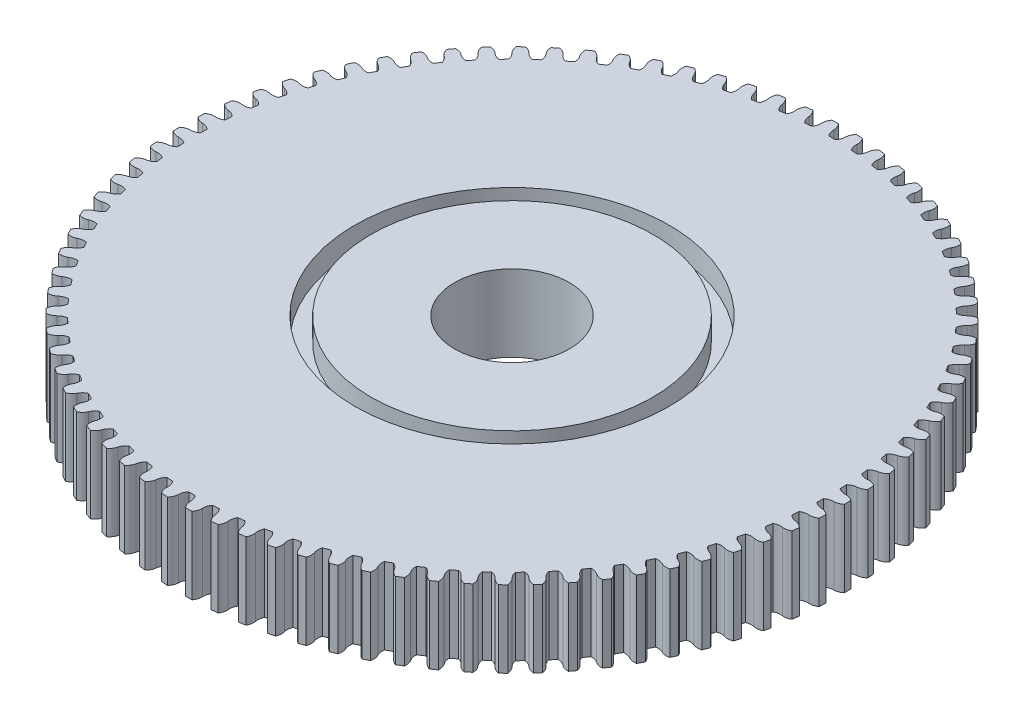
from build123d import *

# Parameters (mm, degrees)
CROQUIS1_R              = 43
SALIENTE_EXTRUIR1_DEPTH = 10
CROQUIS4_R              = 7.5
CORTAR_EXTRUIR2_DEPTH   = 62.627915753
CORTAR_EXTRUIR3_DEPTH   = 62.627915753
CROQUIS6_R              = 1.65
CORTAR_EXTRUIR5_DEPTH   = 6
CORTAR_EXTRUIR6_DEPTH   = 3
CORTAR_EXTRUIR7_DEPTH   = 3


with BuildPart() as part:
    # Croquis1 → Saliente-Extruir1 (new body)
    with BuildSketch(Plane(origin=(0, 0, 0), x_dir=(1, 0, 0), z_dir=(0, 1, 0))):
        Circle(CROQUIS1_R)
    extrude(amount=SALIENTE_EXTRUIR1_DEPTH)

    # Croquis4 → Cortar-Extruir2 (cut, through all)
    with BuildSketch(Plane(origin=(0, 0, 0), x_dir=(1, 0, 0), z_dir=(0, 1, 0))):
        Circle(CROQUIS4_R)
    extrude(amount=CORTAR_EXTRUIR2_DEPTH, mode=Mode.SUBTRACT)

    # Croquis2 → Cortar-Extruir3 (cut, through all)
    with BuildSketch(Plane(origin=(0, 10, 0), x_dir=(1, 0, 0), z_dir=(0, 1, 0))):
        with BuildLine():
            ThreePointArc((1.99012781, 42.953921722), (0.804098119, 42.992481043), (-0.382543954, 42.99829834))
            ThreePointArc((-0.382543954, 42.99829834), (-0.103729383, 42.532695144), (0, 42))
            ThreePointArc((0, 42), (0.081582707, 41.470164492), (0.336584062, 40.998618406))
            ThreePointArc((0.336584062, 40.998618406), (0.766698206, 40.992830762), (1.196727958, 40.982530939))
            ThreePointArc((1.196727958, 40.982530939), (1.46918367, 41.444211877), (1.570521656, 41.970626177))
            ThreePointArc((1.570521656, 41.970626177), (1.694097762, 42.499069975), (1.99012781, 42.953921722))
        make_face()
        with BuildLine():
            ThreePointArc((5.194513599, 42.685091408), (4.014681829, 42.812175018), (2.831792575, 42.906653922))
            ThreePointArc((2.831792575, 42.906653922), (3.075032953, 42.421516808), (3.138663931, 41.882559482))
            ThreePointArc((3.138663931, 41.882559482), (3.180423858, 41.348108818), (3.399473495, 40.858824995))
            ThreePointArc((3.399473495, 40.858824995), (3.827952442, 40.820911064), (4.256010036, 40.778503879))
            ThreePointArc((4.256010036, 40.778503879), (4.562205367, 41.218533222), (4.702598981, 41.735902564))
            ThreePointArc((4.702598981, 41.735902564), (4.865320198, 42.253633871), (5.194513599, 42.685091408))
        make_face()
        with BuildLine():
            ThreePointArc((8.369849561, 42.177548747), (7.20281381, 42.392445945), (6.030292572, 42.575058091))
            ThreePointArc((6.030292572, 42.575058091), (6.236598459, 42.073100143), (6.259775179, 41.530894701))
            ThreePointArc((6.259775179, 41.530894701), (6.26147879, 40.994817747), (6.443351694, 40.490532461))
            ThreePointArc((6.443351694, 40.490532461), (6.867799214, 40.420704273), (7.29149078, 40.346426883))
            ThreePointArc((7.29149078, 40.346426883), (7.629713361, 40.762343809), (7.808377465, 41.267774853))
            ThreePointArc((7.808377465, 41.267774853), (8.009333789, 41.771898308), (8.369849561, 42.177548747))
        make_face()
        with BuildLine():
            ThreePointArc((11.49837793, 41.434132125), (10.350664735, 41.735641118), (9.195068727, 42.005365266))
            ThreePointArc((9.195068727, 42.005365266), (9.363286376, 41.489393635), (9.345879226, 40.946972312))
            ThreePointArc((9.345879226, 40.946972312), (9.307516992, 40.412267026), (9.451196056, 39.895800445))
            ThreePointArc((9.451196056, 39.895800445), (9.869238468, 39.794448508), (10.28619455, 39.688716302))
            ThreePointArc((10.28619455, 39.688716302), (10.654552902, 40.078194835), (10.870488335, 40.568861006))
            ThreePointArc((10.870488335, 40.568861006), (11.108555937, 41.056557344), (11.49837793, 41.434132125))
        make_face()
        with BuildLine():
            ThreePointArc((14.562602704, 40.45899903), (13.440630544, 40.845433657), (12.308422327, 41.200761399))
            ThreePointArc((12.308422327, 41.200761399), (12.437610997, 40.673661609), (12.379717325, 40.134057843))
            ThreePointArc((12.379717325, 40.134057843), (12.301503784, 39.603714515), (12.406185496, 39.077954929))
            ThreePointArc((12.406185496, 39.077954929), (12.815484937, 38.945646045), (13.223373747, 38.80905032))
            ThreePointArc((13.223373747, 38.80905032), (13.619807862, 39.169912338), (13.871807025, 39.643069632))
            ThreePointArc((13.871807025, 39.643069632), (14.145654535, 40.111611458), (14.562602704, 40.45899903))
        make_face()
        with BuildLine():
            ThreePointArc((17.545387497, 39.2576028), (16.455430894, 39.726801961), (15.352942237, 40.165746161))
            ThreePointArc((15.352942237, 40.165746161), (15.442379453, 39.630465968), (15.344323023, 39.096697443))
            ThreePointArc((15.344323023, 39.096697443), (15.226695576, 38.573681968), (15.291794514, 38.041569638))
            ThreePointArc((15.291794514, 38.041569638), (15.690062016, 37.879043731), (16.086602475, 37.712348386))
            ThreePointArc((16.086602475, 37.712348386), (16.508895332, 38.042575802), (16.795548943, 38.495578132))
            ThreePointArc((16.795548943, 38.495578132), (17.103644894, 38.94234517), (17.545387497, 39.2576028))
        make_face()
        with BuildLine():
            ThreePointArc((20.430051367, 37.83666213), (19.378205801, 38.386001875), (18.311602266, 38.906107778))
            ThreePointArc((18.311602266, 38.906107778), (18.360787858, 38.365640685), (18.223117043, 37.840692452))
            ThreePointArc((18.223117043, 37.840692452), (18.06673351, 37.327929745), (18.091885614, 36.792440459))
            ThreePointArc((18.091885614, 36.792440459), (18.476893903, 36.600606439), (18.859868396, 36.404743703))
            ThreePointArc((18.859868396, 36.404743703), (19.305658362, 36.702489752), (19.625363338, 37.132803744))
            ThreePointArc((19.625363338, 37.132803744), (19.965984733, 37.555297491), (20.430051367, 37.83666213))
        make_face()
        with BuildLine():
            ThreePointArc((23.200462101, 36.204123498), (22.192609919, 36.830531695), (21.167856388, 37.428890659))
            ThreePointArc((21.167856388, 37.428890659), (21.176515291, 36.886259178), (21, 36.373066959))
            ThreePointArc((21, 36.373066959), (20.805734943, 35.873424596), (20.790799551, 35.337553028))
            ThreePointArc((20.790799551, 35.337553028), (21.160395505, 35.11748371), (21.527662283, 34.893548926))
            ThreePointArc((21.527662283, 34.893548926), (21.99445632, 35.15714849), (22.34542474, 35.562367654))
            ThreePointArc((22.34542474, 35.562367654), (22.716666686, 35.958225355), (23.200462101, 36.204123498))
        make_face()
        with BuildLine():
            ThreePointArc((25.841126441, 34.369116722), (24.882903961, 35.069090243), (23.90573127, 35.742356))
            ThreePointArc((23.90573127, 35.742356), (23.873815059, 35.200594746), (23.659442439, 34.702028521))
            ThreePointArc((23.659442439, 34.702028521), (23.428382265, 34.218300706), (23.373442904, 33.685043667))
            ThreePointArc((23.373442904, 33.685043667), (23.725559591, 33.437969766), (24.075064749, 33.187215269))
            ThreePointArc((24.075064749, 33.187215269), (24.560252356, 33.415194193), (24.940521464, 33.793052379))
            ThreePointArc((24.940521464, 33.793052379), (25.340307824, 34.160060236), (25.841126441, 34.369116722))
        make_face()
        with BuildLine():
            ThreePointArc((28.33727672, 32.341903904), (27.434042711, 33.111528212), (26.509915605, 33.855935589))
            ThreePointArc((26.509915605, 33.855935589), (26.43760277, 33.31807431), (26.186571678, 32.836922264))
            ThreePointArc((26.186571678, 32.836922264), (25.920008571, 32.371814198), (25.825372483, 31.844153877))
            ThreePointArc((25.825372483, 31.844153877), (26.158040724, 31.571457132), (26.487829688, 31.295285242))
            ThreePointArc((26.487829688, 31.295285242), (26.988697498, 31.486368576), (27.396140674, 31.834752648))
            ThreePointArc((27.396140674, 31.834752648), (27.822235683, 32.170858204), (28.33727672, 32.341903904))
        make_face()
        with BuildLine():
            ThreePointArc((30.674953452, 30.13382204), (29.831759166, 30.968793084), (28.96584574, 31.780179052))
            ThreePointArc((28.96584574, 31.780179052), (28.853540682, 31.249225688), (28.567254986, 30.788178617))
            ThreePointArc((28.567254986, 30.788178617), (28.266679674, 30.344291373), (28.132876103, 29.825178662))
            ThreePointArc((28.132876103, 29.825178662), (28.444235483, 29.528384104), (28.752463939, 29.228339286))
            ThreePointArc((28.752463939, 29.228339286), (29.266210897, 29.381458414), (29.698549553, 29.698420066))
            ThreePointArc((29.698549553, 29.698420066), (30.148570313, 30.001743683), (30.674953452, 30.13382204))
        make_face()
        with BuildLine():
            ThreePointArc((32.841083402, 27.757219619), (32.062644322, 28.652867903), (31.259787115, 29.526694863))
            ThreePointArc((31.259787115, 29.526694863), (31.10811789, 29.005618719), (30.788178617, 28.567254986))
            ThreePointArc((30.788178617, 28.567254986), (30.455272039, 28.147070963), (30.283049268, 27.639408949))
            ThreePointArc((30.283049268, 27.639408949), (30.571358539, 27.320176373), (30.856302749, 26.9979366))
            ThreePointArc((30.856302749, 26.9979366), (31.380055772, 27.112235218), (31.834872096, 27.396001873))
            ThreePointArc((31.834872096, 27.396001873), (32.306301909, 27.664847242), (32.841083402, 27.757219619))
        make_face()
        with BuildLine():
            ThreePointArc((34.823552692, 25.225387567), (34.114222165, 26.176704263), (33.378911081, 27.108085419))
            ThreePointArc((33.378911081, 27.108085419), (33.188725885, 26.599800565), (32.836922264, 26.186571678))
            ThreePointArc((32.836922264, 26.186571678), (32.473546169, 25.792440714), (32.263867338, 25.29906845))
            ThreePointArc((32.263867338, 25.29906845), (32.527514158, 24.959183134), (32.787580597, 24.616550502))
            ThreePointArc((32.787580597, 24.616550502), (33.318410647, 24.691389404), (33.793161121, 24.940374124))
            ThreePointArc((33.793161121, 24.940374124), (34.28336356, 25.173237753), (34.823552692, 25.225387567))
        make_face()
        with BuildLine():
            ThreePointArc((36.611274549, 22.552484916), (35.975019441, 23.554149873), (35.311366636, 24.537876565))
            ThreePointArc((35.311366636, 24.537876565), (35.083729062, 24.045225537), (34.702028521, 23.659442439))
            ThreePointArc((34.702028521, 23.659442439), (34.310215056, 23.293568674), (34.064252774, 22.817245298))
            ThreePointArc((34.064252774, 22.817245298), (34.301762722, 22.458608019), (34.535496994, 22.097498667))
            ThreePointArc((34.535496994, 22.097498667), (35.070435454, 22.132459326), (35.562465081, 22.345269687))
            ThreePointArc((35.562465081, 22.345269687), (36.068698735, 22.540849307), (36.611274549, 22.552484916))
        make_face()
        with BuildLine():
            ThreePointArc((38.194251308, 19.753459621), (37.634629814, 20.799871123), (37.046346705, 21.830441952))
            ThreePointArc((37.046346705, 21.830441952), (36.782529794, 21.356179853), (36.373066959, 21))
            ThreePointArc((36.373066959, 21), (35.955007303, 20.66442955), (35.67413709, 20.207818854))
            ThreePointArc((35.67413709, 20.207818854), (35.884181916, 19.832435257), (36.090276884, 19.454868657))
            ThreePointArc((36.090276884, 19.454868657), (36.62633216, 19.449755557), (37.132889311, 19.625201437))
            ThreePointArc((37.132889311, 19.625201437), (37.652323117, 19.782403289), (38.194251308, 19.753459621))
        make_face()
        with BuildLine():
            ThreePointArc((39.563630321, 16.843964966), (39.083772072, 17.929271057), (38.574148576, 19.000922653))
            ThreePointArc((38.574148576, 19.000922653), (38.2756277, 18.547701749), (37.840692452, 18.223117043))
            ThreePointArc((37.840692452, 18.223117043), (37.398724564, 17.919726553), (37.084517162, 17.485382091))
            ThreePointArc((37.084517162, 17.485382091), (37.265922208, 17.095351473), (37.443225305, 16.703439129))
            ThreePointArc((37.443225305, 16.703439129), (37.97739956, 16.658280866), (38.495651361, 16.7953811))
            ThreePointArc((38.495651361, 16.7953811), (39.025380434, 16.913326047), (39.563630321, 16.843964966))
        make_face()
        with BuildLine():
            ThreePointArc((40.711753465, 13.840272028), (40.314342022, 14.958403234), (39.886228161, 16.065142486))
            ThreePointArc((39.886228161, 16.065142486), (39.554672769, 15.635497373), (39.096697443, 15.344323023))
            ThreePointArc((39.096697443, 15.344323023), (38.633292987, 15.074809176), (38.287505571, 14.665159978))
            ThreePointArc((38.287505571, 14.665159978), (38.439256347, 14.262663549), (38.586776022, 13.858597194))
            ThreePointArc((38.586776022, 13.858597194), (39.116081937, 13.773646311), (39.643130113, 13.871634179))
            ThreePointArc((39.643130113, 13.871634179), (40.180191993, 13.949662625), (40.711753465, 13.840272028))
        make_face()
        with BuildLine():
            ThreePointArc((41.632199969, 10.759178673), (41.319457819, 11.903881953), (40.975247779, 13.039519526))
            ThreePointArc((40.975247779, 13.039519526), (40.612512064, 12.635852953), (40.134057843, 12.379717325))
            ThreePointArc((40.134057843, 12.379717325), (39.651808365, 12.145587352), (39.276374717, 11.762924342))
            ThreePointArc((39.276374717, 11.762924342), (39.397622572, 11.350213025), (39.514533836, 10.936252362))
            ThreePointArc((39.514533836, 10.936252362), (40.036011316, 10.811983938), (40.568908402, 10.870311453))
            ThreePointArc((40.568908402, 10.870311453), (41.110299621, 10.907987031), (41.632199969, 10.759178673))
        make_face()
        with BuildLine():
            ThreePointArc((42.319822323, 7.617915628), (42.093498447, 8.782789335), (41.83511719, 9.940974284))
            ThreePointArc((41.83511719, 9.940974284), (41.443229717, 9.565543718), (40.946972312, 9.345879226))
            ThreePointArc((40.946972312, 9.345879226), (40.448574746, 9.148442476), (40.045594444, 8.794905661))
            ThreePointArc((40.045594444, 8.794905661), (40.13566131, 8.374287505), (40.221310348, 7.952747571))
            ThreePointArc((40.221310348, 7.952747571), (40.73204308, 7.789856566), (41.267808898, 7.808197536))
            ThreePointArc((41.267808898, 7.808197536), (41.810501777, 7.805309549), (42.319822323, 7.617915628))
        make_face()
        with BuildLine():
            ThreePointArc((42.770775065, 4.434050108), (42.632135157, 5.612579796), (42.461027656, 6.78683508))
            ThreePointArc((42.461027656, 6.78683508), (42.042180018, 6.441740083), (41.530894701, 6.259775179))
            ThreePointArc((41.530894701, 6.259775179), (41.01913629, 6.100135799), (40.590862964, 5.777702301))
            ThreePointArc((40.590862964, 5.777702301), (40.64924515, 5.351529573), (40.703152976, 4.924767789))
            ThreePointArc((40.703152976, 4.924767789), (41.200284736, 4.724165156), (41.735923067, 4.702417011))
            ThreePointArc((41.735923067, 4.702417011), (42.276882647, 4.65898161), (42.770775065, 4.434050108))
        make_face()
        with BuildLine():
            ThreePointArc((42.982536282, 1.225387581), (42.932355674, 2.410982435), (42.849478831, 3.594741143))
            ThreePointArc((42.849478831, 3.594741143), (42.406013395, 3.281911624), (41.882559482, 3.138663931))
            ThreePointArc((41.882559482, 3.138663931), (41.360302185, 3.017714689), (40.909130912, 2.728187685))
            ThreePointArc((40.909130912, 2.728187685), (40.935501922, 2.298843717), (40.957367063, 1.869246709))
            ThreePointArc((40.957367063, 1.869246709), (41.438117688, 1.632054297), (41.970633025, 1.570338663))
            ThreePointArc((41.970633025, 1.570338663), (42.50683404, 1.486598755), (42.982536282, 1.225387581))
        make_face()
        with BuildLine():
            ThreePointArc((42.953921722, -1.99012781), (42.992481043, -0.804098119), (42.99829834, 0.382543954))
            ThreePointArc((42.99829834, 0.382543954), (42.532695144, 0.103729383), (42, 0))
            ThreePointArc((42, 0), (41.470164492, -0.081582707), (40.998618406, -0.336584062))
            ThreePointArc((40.998618406, -0.336584062), (40.992830762, -0.766698206), (40.982530939, -1.196727958))
            ThreePointArc((40.982530939, -1.196727958), (41.444211877, -1.46918367), (41.970626177, -1.570521656))
            ThreePointArc((41.970626177, -1.570521656), (42.499069975, -1.694097762), (42.953921722, -1.99012781))
        make_face()
        with BuildLine():
            ThreePointArc((42.685091408, -5.194513599), (42.812175018, -4.014681829), (42.906653922, -2.831792575))
            ThreePointArc((42.906653922, -2.831792575), (42.421516808, -3.075032953), (41.882559482, -3.138663931))
            ThreePointArc((41.882559482, -3.138663931), (41.348108818, -3.180423858), (40.858824995, -3.399473495))
            ThreePointArc((40.858824995, -3.399473495), (40.820911064, -3.827952442), (40.778503879, -4.256010036))
            ThreePointArc((40.778503879, -4.256010036), (41.218533222, -4.562205367), (41.735902564, -4.702598981))
            ThreePointArc((41.735902564, -4.702598981), (42.253633871, -4.865320198), (42.685091408, -5.194513599))
        make_face()
        with BuildLine():
            ThreePointArc((42.177548747, -8.369849561), (42.392445945, -7.20281381), (42.575058091, -6.030292572))
            ThreePointArc((42.575058091, -6.030292572), (42.073100143, -6.236598459), (41.530894701, -6.259775179))
            ThreePointArc((41.530894701, -6.259775179), (40.994817747, -6.26147879), (40.490532461, -6.443351694))
            ThreePointArc((40.490532461, -6.443351694), (40.420704273, -6.867799214), (40.346426883, -7.29149078))
            ThreePointArc((40.346426883, -7.29149078), (40.762343809, -7.629713361), (41.267774853, -7.808377465))
            ThreePointArc((41.267774853, -7.808377465), (41.771898308, -8.009333789), (42.177548747, -8.369849561))
        make_face()
        with BuildLine():
            ThreePointArc((41.434132125, -11.49837793), (41.735641118, -10.350664735), (42.005365266, -9.195068727))
            ThreePointArc((42.005365266, -9.195068727), (41.489393635, -9.363286376), (40.946972312, -9.345879226))
            ThreePointArc((40.946972312, -9.345879226), (40.412267026, -9.307516992), (39.895800445, -9.451196056))
            ThreePointArc((39.895800445, -9.451196056), (39.794448508, -9.869238468), (39.688716302, -10.28619455))
            ThreePointArc((39.688716302, -10.28619455), (40.078194835, -10.654552902), (40.568861006, -10.870488335))
            ThreePointArc((40.568861006, -10.870488335), (41.056557344, -11.108555937), (41.434132125, -11.49837793))
        make_face()
        with BuildLine():
            ThreePointArc((40.45899903, -14.562602704), (40.845433657, -13.440630544), (41.200761399, -12.308422327))
            ThreePointArc((41.200761399, -12.308422327), (40.673661609, -12.437610997), (40.134057843, -12.379717325))
            ThreePointArc((40.134057843, -12.379717325), (39.603714515, -12.301503784), (39.077954929, -12.406185496))
            ThreePointArc((39.077954929, -12.406185496), (38.945646045, -12.815484937), (38.80905032, -13.223373747))
            ThreePointArc((38.80905032, -13.223373747), (39.169912338, -13.619807862), (39.643069632, -13.871807025))
            ThreePointArc((39.643069632, -13.871807025), (40.111611458, -14.145654535), (40.45899903, -14.562602704))
        make_face()
        with BuildLine():
            ThreePointArc((39.2576028, -17.545387497), (39.726801961, -16.455430894), (40.165746161, -15.352942237))
            ThreePointArc((40.165746161, -15.352942237), (39.630465968, -15.442379453), (39.096697443, -15.344323023))
            ThreePointArc((39.096697443, -15.344323023), (38.573681968, -15.226695576), (38.041569638, -15.291794514))
            ThreePointArc((38.041569638, -15.291794514), (37.879043731, -15.690062016), (37.712348386, -16.086602475))
            ThreePointArc((37.712348386, -16.086602475), (38.042575802, -16.508895332), (38.495578132, -16.795548943))
            ThreePointArc((38.495578132, -16.795548943), (38.94234517, -17.103644894), (39.2576028, -17.545387497))
        make_face()
        with BuildLine():
            ThreePointArc((37.83666213, -20.430051367), (38.386001875, -19.378205801), (38.906107778, -18.311602266))
            ThreePointArc((38.906107778, -18.311602266), (38.365640685, -18.360787858), (37.840692452, -18.223117043))
            ThreePointArc((37.840692452, -18.223117043), (37.327929745, -18.06673351), (36.792440459, -18.091885614))
            ThreePointArc((36.792440459, -18.091885614), (36.600606439, -18.476893903), (36.404743703, -18.859868396))
            ThreePointArc((36.404743703, -18.859868396), (36.702489752, -19.305658362), (37.132803744, -19.625363338))
            ThreePointArc((37.132803744, -19.625363338), (37.555297491, -19.965984733), (37.83666213, -20.430051367))
        make_face()
        with BuildLine():
            ThreePointArc((36.204123498, -23.200462101), (36.830531695, -22.192609919), (37.428890659, -21.167856388))
            ThreePointArc((37.428890659, -21.167856388), (36.886259178, -21.176515291), (36.373066959, -21))
            ThreePointArc((36.373066959, -21), (35.873424596, -20.805734943), (35.337553028, -20.790799551))
            ThreePointArc((35.337553028, -20.790799551), (35.11748371, -21.160395505), (34.893548926, -21.527662283))
            ThreePointArc((34.893548926, -21.527662283), (35.15714849, -21.99445632), (35.562367654, -22.34542474))
            ThreePointArc((35.562367654, -22.34542474), (35.958225355, -22.716666686), (36.204123498, -23.200462101))
        make_face()
        with BuildLine():
            ThreePointArc((34.369116722, -25.841126441), (35.069090243, -24.882903961), (35.742356, -23.90573127))
            ThreePointArc((35.742356, -23.90573127), (35.200594746, -23.873815059), (34.702028521, -23.659442439))
            ThreePointArc((34.702028521, -23.659442439), (34.218300706, -23.428382265), (33.685043667, -23.373442904))
            ThreePointArc((33.685043667, -23.373442904), (33.437969766, -23.725559591), (33.187215269, -24.075064749))
            ThreePointArc((33.187215269, -24.075064749), (33.415194193, -24.560252356), (33.793052379, -24.940521464))
            ThreePointArc((33.793052379, -24.940521464), (34.160060236, -25.340307824), (34.369116722, -25.841126441))
        make_face()
        with BuildLine():
            ThreePointArc((32.341903904, -28.33727672), (33.111528212, -27.434042711), (33.855935589, -26.509915605))
            ThreePointArc((33.855935589, -26.509915605), (33.31807431, -26.43760277), (32.836922264, -26.186571678))
            ThreePointArc((32.836922264, -26.186571678), (32.371814198, -25.920008571), (31.844153877, -25.825372483))
            ThreePointArc((31.844153877, -25.825372483), (31.571457132, -26.158040724), (31.295285242, -26.487829688))
            ThreePointArc((31.295285242, -26.487829688), (31.486368576, -26.988697498), (31.834752648, -27.396140674))
            ThreePointArc((31.834752648, -27.396140674), (32.170858204, -27.822235683), (32.341903904, -28.33727672))
        make_face()
        with BuildLine():
            ThreePointArc((30.13382204, -30.674953452), (30.968793084, -29.831759166), (31.780179052, -28.96584574))
            ThreePointArc((31.780179052, -28.96584574), (31.249225688, -28.853540682), (30.788178617, -28.567254986))
            ThreePointArc((30.788178617, -28.567254986), (30.344291373, -28.266679674), (29.825178662, -28.132876103))
            ThreePointArc((29.825178662, -28.132876103), (29.528384104, -28.444235483), (29.228339286, -28.752463939))
            ThreePointArc((29.228339286, -28.752463939), (29.381458414, -29.266210897), (29.698420066, -29.698549553))
            ThreePointArc((29.698420066, -29.698549553), (30.001743683, -30.148570313), (30.13382204, -30.674953452))
        make_face()
        with BuildLine():
            ThreePointArc((27.757219619, -32.841083402), (28.652867903, -32.062644322), (29.526694863, -31.259787115))
            ThreePointArc((29.526694863, -31.259787115), (29.005618719, -31.10811789), (28.567254986, -30.788178617))
            ThreePointArc((28.567254986, -30.788178617), (28.147070963, -30.455272039), (27.639408949, -30.283049268))
            ThreePointArc((27.639408949, -30.283049268), (27.320176373, -30.571358539), (26.9979366, -30.856302749))
            ThreePointArc((26.9979366, -30.856302749), (27.112235218, -31.380055772), (27.396001873, -31.834872096))
            ThreePointArc((27.396001873, -31.834872096), (27.664847242, -32.306301909), (27.757219619, -32.841083402))
        make_face()
        with BuildLine():
            ThreePointArc((25.225387567, -34.823552692), (26.176704263, -34.114222165), (27.108085419, -33.378911081))
            ThreePointArc((27.108085419, -33.378911081), (26.599800565, -33.188725885), (26.186571678, -32.836922264))
            ThreePointArc((26.186571678, -32.836922264), (25.792440714, -32.473546169), (25.29906845, -32.263867338))
            ThreePointArc((25.29906845, -32.263867338), (24.959183134, -32.527514158), (24.616550502, -32.787580597))
            ThreePointArc((24.616550502, -32.787580597), (24.691389404, -33.318410647), (24.940374124, -33.793161121))
            ThreePointArc((24.940374124, -33.793161121), (25.173237753, -34.28336356), (25.225387567, -34.823552692))
        make_face()
        with BuildLine():
            ThreePointArc((22.552484916, -36.611274549), (23.554149873, -35.975019441), (24.537876565, -35.311366636))
            ThreePointArc((24.537876565, -35.311366636), (24.045225537, -35.083729062), (23.659442439, -34.702028521))
            ThreePointArc((23.659442439, -34.702028521), (23.293568674, -34.310215056), (22.817245298, -34.064252774))
            ThreePointArc((22.817245298, -34.064252774), (22.458608019, -34.301762722), (22.097498667, -34.535496994))
            ThreePointArc((22.097498667, -34.535496994), (22.132459326, -35.070435454), (22.345269687, -35.562465081))
            ThreePointArc((22.345269687, -35.562465081), (22.540849307, -36.068698735), (22.552484916, -36.611274549))
        make_face()
        with BuildLine():
            ThreePointArc((19.753459621, -38.194251308), (20.799871123, -37.634629814), (21.830441952, -37.046346705))
            ThreePointArc((21.830441952, -37.046346705), (21.356179853, -36.782529794), (21, -36.373066959))
            ThreePointArc((21, -36.373066959), (20.66442955, -35.955007303), (20.207818854, -35.67413709))
            ThreePointArc((20.207818854, -35.67413709), (19.832435257, -35.884181916), (19.454868657, -36.090276884))
            ThreePointArc((19.454868657, -36.090276884), (19.449755557, -36.62633216), (19.625201437, -37.132889311))
            ThreePointArc((19.625201437, -37.132889311), (19.782403289, -37.652323117), (19.753459621, -38.194251308))
        make_face()
        with BuildLine():
            ThreePointArc((16.843964966, -39.563630321), (17.929271057, -39.083772072), (19.000922653, -38.574148576))
            ThreePointArc((19.000922653, -38.574148576), (18.547701749, -38.2756277), (18.223117043, -37.840692452))
            ThreePointArc((18.223117043, -37.840692452), (17.919726553, -37.398724564), (17.485382091, -37.084517162))
            ThreePointArc((17.485382091, -37.084517162), (17.095351473, -37.265922208), (16.703439129, -37.443225305))
            ThreePointArc((16.703439129, -37.443225305), (16.658280866, -37.97739956), (16.7953811, -38.495651361))
            ThreePointArc((16.7953811, -38.495651361), (16.913326047, -39.025380434), (16.843964966, -39.563630321))
        make_face()
        with BuildLine():
            ThreePointArc((13.840272028, -40.711753465), (14.958403234, -40.314342022), (16.065142486, -39.886228161))
            ThreePointArc((16.065142486, -39.886228161), (15.635497373, -39.554672769), (15.344323023, -39.096697443))
            ThreePointArc((15.344323023, -39.096697443), (15.074809176, -38.633292987), (14.665159978, -38.287505571))
            ThreePointArc((14.665159978, -38.287505571), (14.262663549, -38.439256347), (13.858597194, -38.586776022))
            ThreePointArc((13.858597194, -38.586776022), (13.773646311, -39.116081937), (13.871634179, -39.643130113))
            ThreePointArc((13.871634179, -39.643130113), (13.949662625, -40.180191993), (13.840272028, -40.711753465))
        make_face()
        with BuildLine():
            ThreePointArc((10.759178673, -41.632199969), (11.903881953, -41.319457819), (13.039519526, -40.975247779))
            ThreePointArc((13.039519526, -40.975247779), (12.635852953, -40.612512064), (12.379717325, -40.134057843))
            ThreePointArc((12.379717325, -40.134057843), (12.145587352, -39.651808365), (11.762924342, -39.276374717))
            ThreePointArc((11.762924342, -39.276374717), (11.350213025, -39.397622572), (10.936252362, -39.514533836))
            ThreePointArc((10.936252362, -39.514533836), (10.811983938, -40.036011316), (10.870311453, -40.568908402))
            ThreePointArc((10.870311453, -40.568908402), (10.907987031, -41.110299621), (10.759178673, -41.632199969))
        make_face()
        with BuildLine():
            ThreePointArc((7.617915628, -42.319822323), (8.782789335, -42.093498447), (9.940974284, -41.83511719))
            ThreePointArc((9.940974284, -41.83511719), (9.565543718, -41.443229717), (9.345879226, -40.946972312))
            ThreePointArc((9.345879226, -40.946972312), (9.148442476, -40.448574746), (8.794905661, -40.045594444))
            ThreePointArc((8.794905661, -40.045594444), (8.374287505, -40.13566131), (7.952747571, -40.221310348))
            ThreePointArc((7.952747571, -40.221310348), (7.789856566, -40.73204308), (7.808197536, -41.267808898))
            ThreePointArc((7.808197536, -41.267808898), (7.805309549, -41.810501777), (7.617915628, -42.319822323))
        make_face()
        with BuildLine():
            ThreePointArc((4.434050108, -42.770775065), (5.612579796, -42.632135157), (6.78683508, -42.461027656))
            ThreePointArc((6.78683508, -42.461027656), (6.441740083, -42.042180018), (6.259775179, -41.530894701))
            ThreePointArc((6.259775179, -41.530894701), (6.100135799, -41.01913629), (5.777702301, -40.590862964))
            ThreePointArc((5.777702301, -40.590862964), (5.351529573, -40.64924515), (4.924767789, -40.703152976))
            ThreePointArc((4.924767789, -40.703152976), (4.724165156, -41.200284736), (4.702417011, -41.735923067))
            ThreePointArc((4.702417011, -41.735923067), (4.65898161, -42.276882647), (4.434050108, -42.770775065))
        make_face()
        with BuildLine():
            ThreePointArc((1.225387581, -42.982536282), (2.410982435, -42.932355674), (3.594741143, -42.849478831))
            ThreePointArc((3.594741143, -42.849478831), (3.281911624, -42.406013395), (3.138663931, -41.882559482))
            ThreePointArc((3.138663931, -41.882559482), (3.017714689, -41.360302185), (2.728187685, -40.909130912))
            ThreePointArc((2.728187685, -40.909130912), (2.298843717, -40.935501922), (1.869246709, -40.957367063))
            ThreePointArc((1.869246709, -40.957367063), (1.632054297, -41.438117688), (1.570338663, -41.970633025))
            ThreePointArc((1.570338663, -41.970633025), (1.486598755, -42.50683404), (1.225387581, -42.982536282))
        make_face()
        with BuildLine():
            ThreePointArc((-1.99012781, -42.953921722), (-0.804098119, -42.992481043), (0.382543954, -42.99829834))
            ThreePointArc((0.382543954, -42.99829834), (0.103729383, -42.532695144), (0, -42))
            ThreePointArc((0, -42), (-0.081582707, -41.470164492), (-0.336584062, -40.998618406))
            ThreePointArc((-0.336584062, -40.998618406), (-0.766698206, -40.992830762), (-1.196727958, -40.982530939))
            ThreePointArc((-1.196727958, -40.982530939), (-1.46918367, -41.444211877), (-1.570521656, -41.970626177))
            ThreePointArc((-1.570521656, -41.970626177), (-1.694097762, -42.499069975), (-1.99012781, -42.953921722))
        make_face()
        with BuildLine():
            ThreePointArc((-5.194513599, -42.685091408), (-4.014681829, -42.812175018), (-2.831792575, -42.906653922))
            ThreePointArc((-2.831792575, -42.906653922), (-3.075032953, -42.421516808), (-3.138663931, -41.882559482))
            ThreePointArc((-3.138663931, -41.882559482), (-3.180423858, -41.348108818), (-3.399473495, -40.858824995))
            ThreePointArc((-3.399473495, -40.858824995), (-3.827952442, -40.820911064), (-4.256010036, -40.778503879))
            ThreePointArc((-4.256010036, -40.778503879), (-4.562205367, -41.218533222), (-4.702598981, -41.735902564))
            ThreePointArc((-4.702598981, -41.735902564), (-4.865320198, -42.253633871), (-5.194513599, -42.685091408))
        make_face()
        with BuildLine():
            ThreePointArc((-8.369849561, -42.177548747), (-7.20281381, -42.392445945), (-6.030292572, -42.575058091))
            ThreePointArc((-6.030292572, -42.575058091), (-6.236598459, -42.073100143), (-6.259775179, -41.530894701))
            ThreePointArc((-6.259775179, -41.530894701), (-6.26147879, -40.994817747), (-6.443351694, -40.490532461))
            ThreePointArc((-6.443351694, -40.490532461), (-6.867799214, -40.420704273), (-7.29149078, -40.346426883))
            ThreePointArc((-7.29149078, -40.346426883), (-7.629713361, -40.762343809), (-7.808377465, -41.267774853))
            ThreePointArc((-7.808377465, -41.267774853), (-8.009333789, -41.771898308), (-8.369849561, -42.177548747))
        make_face()
        with BuildLine():
            ThreePointArc((-11.49837793, -41.434132125), (-10.350664735, -41.735641118), (-9.195068727, -42.005365266))
            ThreePointArc((-9.195068727, -42.005365266), (-9.363286376, -41.489393635), (-9.345879226, -40.946972312))
            ThreePointArc((-9.345879226, -40.946972312), (-9.307516992, -40.412267026), (-9.451196056, -39.895800445))
            ThreePointArc((-9.451196056, -39.895800445), (-9.869238468, -39.794448508), (-10.28619455, -39.688716302))
            ThreePointArc((-10.28619455, -39.688716302), (-10.654552902, -40.078194835), (-10.870488335, -40.568861006))
            ThreePointArc((-10.870488335, -40.568861006), (-11.108555937, -41.056557344), (-11.49837793, -41.434132125))
        make_face()
        with BuildLine():
            ThreePointArc((-14.562602704, -40.45899903), (-13.440630544, -40.845433657), (-12.308422327, -41.200761399))
            ThreePointArc((-12.308422327, -41.200761399), (-12.437610997, -40.673661609), (-12.379717325, -40.134057843))
            ThreePointArc((-12.379717325, -40.134057843), (-12.301503784, -39.603714515), (-12.406185496, -39.077954929))
            ThreePointArc((-12.406185496, -39.077954929), (-12.815484937, -38.945646045), (-13.223373747, -38.80905032))
            ThreePointArc((-13.223373747, -38.80905032), (-13.619807862, -39.169912338), (-13.871807025, -39.643069632))
            ThreePointArc((-13.871807025, -39.643069632), (-14.145654535, -40.111611458), (-14.562602704, -40.45899903))
        make_face()
        with BuildLine():
            ThreePointArc((-17.545387497, -39.2576028), (-16.455430894, -39.726801961), (-15.352942237, -40.165746161))
            ThreePointArc((-15.352942237, -40.165746161), (-15.442379453, -39.630465968), (-15.344323023, -39.096697443))
            ThreePointArc((-15.344323023, -39.096697443), (-15.226695576, -38.573681968), (-15.291794514, -38.041569638))
            ThreePointArc((-15.291794514, -38.041569638), (-15.690062016, -37.879043731), (-16.086602475, -37.712348386))
            ThreePointArc((-16.086602475, -37.712348386), (-16.508895332, -38.042575802), (-16.795548943, -38.495578132))
            ThreePointArc((-16.795548943, -38.495578132), (-17.103644894, -38.94234517), (-17.545387497, -39.2576028))
        make_face()
        with BuildLine():
            ThreePointArc((-20.430051367, -37.83666213), (-19.378205801, -38.386001875), (-18.311602266, -38.906107778))
            ThreePointArc((-18.311602266, -38.906107778), (-18.360787858, -38.365640685), (-18.223117043, -37.840692452))
            ThreePointArc((-18.223117043, -37.840692452), (-18.06673351, -37.327929745), (-18.091885614, -36.792440459))
            ThreePointArc((-18.091885614, -36.792440459), (-18.476893903, -36.600606439), (-18.859868396, -36.404743703))
            ThreePointArc((-18.859868396, -36.404743703), (-19.305658362, -36.702489752), (-19.625363338, -37.132803744))
            ThreePointArc((-19.625363338, -37.132803744), (-19.965984733, -37.555297491), (-20.430051367, -37.83666213))
        make_face()
        with BuildLine():
            ThreePointArc((-23.200462101, -36.204123498), (-22.192609919, -36.830531695), (-21.167856388, -37.428890659))
            ThreePointArc((-21.167856388, -37.428890659), (-21.176515291, -36.886259178), (-21, -36.373066959))
            ThreePointArc((-21, -36.373066959), (-20.805734943, -35.873424596), (-20.790799551, -35.337553028))
            ThreePointArc((-20.790799551, -35.337553028), (-21.160395505, -35.11748371), (-21.527662283, -34.893548926))
            ThreePointArc((-21.527662283, -34.893548926), (-21.99445632, -35.15714849), (-22.34542474, -35.562367654))
            ThreePointArc((-22.34542474, -35.562367654), (-22.716666686, -35.958225355), (-23.200462101, -36.204123498))
        make_face()
        with BuildLine():
            ThreePointArc((-25.841126441, -34.369116722), (-24.882903961, -35.069090243), (-23.90573127, -35.742356))
            ThreePointArc((-23.90573127, -35.742356), (-23.873815059, -35.200594746), (-23.659442439, -34.702028521))
            ThreePointArc((-23.659442439, -34.702028521), (-23.428382265, -34.218300706), (-23.373442904, -33.685043667))
            ThreePointArc((-23.373442904, -33.685043667), (-23.725559591, -33.437969766), (-24.075064749, -33.187215269))
            ThreePointArc((-24.075064749, -33.187215269), (-24.560252356, -33.415194193), (-24.940521464, -33.793052379))
            ThreePointArc((-24.940521464, -33.793052379), (-25.340307824, -34.160060236), (-25.841126441, -34.369116722))
        make_face()
        with BuildLine():
            ThreePointArc((-28.33727672, -32.341903904), (-27.434042711, -33.111528212), (-26.509915605, -33.855935589))
            ThreePointArc((-26.509915605, -33.855935589), (-26.43760277, -33.31807431), (-26.186571678, -32.836922264))
            ThreePointArc((-26.186571678, -32.836922264), (-25.920008571, -32.371814198), (-25.825372483, -31.844153877))
            ThreePointArc((-25.825372483, -31.844153877), (-26.158040724, -31.571457132), (-26.487829688, -31.295285242))
            ThreePointArc((-26.487829688, -31.295285242), (-26.988697498, -31.486368576), (-27.396140674, -31.834752648))
            ThreePointArc((-27.396140674, -31.834752648), (-27.822235683, -32.170858204), (-28.33727672, -32.341903904))
        make_face()
        with BuildLine():
            ThreePointArc((-30.674953452, -30.13382204), (-29.831759166, -30.968793084), (-28.96584574, -31.780179052))
            ThreePointArc((-28.96584574, -31.780179052), (-28.853540682, -31.249225688), (-28.567254986, -30.788178617))
            ThreePointArc((-28.567254986, -30.788178617), (-28.266679674, -30.344291373), (-28.132876103, -29.825178662))
            ThreePointArc((-28.132876103, -29.825178662), (-28.444235483, -29.528384104), (-28.752463939, -29.228339286))
            ThreePointArc((-28.752463939, -29.228339286), (-29.266210897, -29.381458414), (-29.698549553, -29.698420066))
            ThreePointArc((-29.698549553, -29.698420066), (-30.148570313, -30.001743683), (-30.674953452, -30.13382204))
        make_face()
        with BuildLine():
            ThreePointArc((-32.841083402, -27.757219619), (-32.062644322, -28.652867903), (-31.259787115, -29.526694863))
            ThreePointArc((-31.259787115, -29.526694863), (-31.10811789, -29.005618719), (-30.788178617, -28.567254986))
            ThreePointArc((-30.788178617, -28.567254986), (-30.455272039, -28.147070963), (-30.283049268, -27.639408949))
            ThreePointArc((-30.283049268, -27.639408949), (-30.571358539, -27.320176373), (-30.856302749, -26.9979366))
            ThreePointArc((-30.856302749, -26.9979366), (-31.380055772, -27.112235218), (-31.834872096, -27.396001873))
            ThreePointArc((-31.834872096, -27.396001873), (-32.306301909, -27.664847242), (-32.841083402, -27.757219619))
        make_face()
        with BuildLine():
            ThreePointArc((-34.823552692, -25.225387567), (-34.114222165, -26.176704263), (-33.378911081, -27.108085419))
            ThreePointArc((-33.378911081, -27.108085419), (-33.188725885, -26.599800565), (-32.836922264, -26.186571678))
            ThreePointArc((-32.836922264, -26.186571678), (-32.473546169, -25.792440714), (-32.263867338, -25.29906845))
            ThreePointArc((-32.263867338, -25.29906845), (-32.527514158, -24.959183134), (-32.787580597, -24.616550502))
            ThreePointArc((-32.787580597, -24.616550502), (-33.318410647, -24.691389404), (-33.793161121, -24.940374124))
            ThreePointArc((-33.793161121, -24.940374124), (-34.28336356, -25.173237753), (-34.823552692, -25.225387567))
        make_face()
        with BuildLine():
            ThreePointArc((-36.611274549, -22.552484916), (-35.975019441, -23.554149873), (-35.311366636, -24.537876565))
            ThreePointArc((-35.311366636, -24.537876565), (-35.083729062, -24.045225537), (-34.702028521, -23.659442439))
            ThreePointArc((-34.702028521, -23.659442439), (-34.310215056, -23.293568674), (-34.064252774, -22.817245298))
            ThreePointArc((-34.064252774, -22.817245298), (-34.301762722, -22.458608019), (-34.535496994, -22.097498667))
            ThreePointArc((-34.535496994, -22.097498667), (-35.070435454, -22.132459326), (-35.562465081, -22.345269687))
            ThreePointArc((-35.562465081, -22.345269687), (-36.068698735, -22.540849307), (-36.611274549, -22.552484916))
        make_face()
        with BuildLine():
            ThreePointArc((-38.194251308, -19.753459621), (-37.634629814, -20.799871123), (-37.046346705, -21.830441952))
            ThreePointArc((-37.046346705, -21.830441952), (-36.782529794, -21.356179853), (-36.373066959, -21))
            ThreePointArc((-36.373066959, -21), (-35.955007303, -20.66442955), (-35.67413709, -20.207818854))
            ThreePointArc((-35.67413709, -20.207818854), (-35.884181916, -19.832435257), (-36.090276884, -19.454868657))
            ThreePointArc((-36.090276884, -19.454868657), (-36.62633216, -19.449755557), (-37.132889311, -19.625201437))
            ThreePointArc((-37.132889311, -19.625201437), (-37.652323117, -19.782403289), (-38.194251308, -19.753459621))
        make_face()
        with BuildLine():
            ThreePointArc((-39.563630321, -16.843964966), (-39.083772072, -17.929271057), (-38.574148576, -19.000922653))
            ThreePointArc((-38.574148576, -19.000922653), (-38.2756277, -18.547701749), (-37.840692452, -18.223117043))
            ThreePointArc((-37.840692452, -18.223117043), (-37.398724564, -17.919726553), (-37.084517162, -17.485382091))
            ThreePointArc((-37.084517162, -17.485382091), (-37.265922208, -17.095351473), (-37.443225305, -16.703439129))
            ThreePointArc((-37.443225305, -16.703439129), (-37.97739956, -16.658280866), (-38.495651361, -16.7953811))
            ThreePointArc((-38.495651361, -16.7953811), (-39.025380434, -16.913326047), (-39.563630321, -16.843964966))
        make_face()
        with BuildLine():
            ThreePointArc((-40.711753465, -13.840272028), (-40.314342022, -14.958403234), (-39.886228161, -16.065142486))
            ThreePointArc((-39.886228161, -16.065142486), (-39.554672769, -15.635497373), (-39.096697443, -15.344323023))
            ThreePointArc((-39.096697443, -15.344323023), (-38.633292987, -15.074809176), (-38.287505571, -14.665159978))
            ThreePointArc((-38.287505571, -14.665159978), (-38.439256347, -14.262663549), (-38.586776022, -13.858597194))
            ThreePointArc((-38.586776022, -13.858597194), (-39.116081937, -13.773646311), (-39.643130113, -13.871634179))
            ThreePointArc((-39.643130113, -13.871634179), (-40.180191993, -13.949662625), (-40.711753465, -13.840272028))
        make_face()
        with BuildLine():
            ThreePointArc((-41.632199969, -10.759178673), (-41.319457819, -11.903881953), (-40.975247779, -13.039519526))
            ThreePointArc((-40.975247779, -13.039519526), (-40.612512064, -12.635852953), (-40.134057843, -12.379717325))
            ThreePointArc((-40.134057843, -12.379717325), (-39.651808365, -12.145587352), (-39.276374717, -11.762924342))
            ThreePointArc((-39.276374717, -11.762924342), (-39.397622572, -11.350213025), (-39.514533836, -10.936252362))
            ThreePointArc((-39.514533836, -10.936252362), (-40.036011316, -10.811983938), (-40.568908402, -10.870311453))
            ThreePointArc((-40.568908402, -10.870311453), (-41.110299621, -10.907987031), (-41.632199969, -10.759178673))
        make_face()
        with BuildLine():
            ThreePointArc((-42.319822323, -7.617915628), (-42.093498447, -8.782789335), (-41.83511719, -9.940974284))
            ThreePointArc((-41.83511719, -9.940974284), (-41.443229717, -9.565543718), (-40.946972312, -9.345879226))
            ThreePointArc((-40.946972312, -9.345879226), (-40.448574746, -9.148442476), (-40.045594444, -8.794905661))
            ThreePointArc((-40.045594444, -8.794905661), (-40.13566131, -8.374287505), (-40.221310348, -7.952747571))
            ThreePointArc((-40.221310348, -7.952747571), (-40.73204308, -7.789856566), (-41.267808898, -7.808197536))
            ThreePointArc((-41.267808898, -7.808197536), (-41.810501777, -7.805309549), (-42.319822323, -7.617915628))
        make_face()
        with BuildLine():
            ThreePointArc((-42.770775065, -4.434050108), (-42.632135157, -5.612579796), (-42.461027656, -6.78683508))
            ThreePointArc((-42.461027656, -6.78683508), (-42.042180018, -6.441740083), (-41.530894701, -6.259775179))
            ThreePointArc((-41.530894701, -6.259775179), (-41.01913629, -6.100135799), (-40.590862964, -5.777702301))
            ThreePointArc((-40.590862964, -5.777702301), (-40.64924515, -5.351529573), (-40.703152976, -4.924767789))
            ThreePointArc((-40.703152976, -4.924767789), (-41.200284736, -4.724165156), (-41.735923067, -4.702417011))
            ThreePointArc((-41.735923067, -4.702417011), (-42.276882647, -4.65898161), (-42.770775065, -4.434050108))
        make_face()
        with BuildLine():
            ThreePointArc((-42.982536282, -1.225387581), (-42.932355674, -2.410982435), (-42.849478831, -3.594741143))
            ThreePointArc((-42.849478831, -3.594741143), (-42.406013395, -3.281911624), (-41.882559482, -3.138663931))
            ThreePointArc((-41.882559482, -3.138663931), (-41.360302185, -3.017714689), (-40.909130912, -2.728187685))
            ThreePointArc((-40.909130912, -2.728187685), (-40.935501922, -2.298843717), (-40.957367063, -1.869246709))
            ThreePointArc((-40.957367063, -1.869246709), (-41.438117688, -1.632054297), (-41.970633025, -1.570338663))
            ThreePointArc((-41.970633025, -1.570338663), (-42.50683404, -1.486598755), (-42.982536282, -1.225387581))
        make_face()
        with BuildLine():
            ThreePointArc((-42.953921722, 1.99012781), (-42.992481043, 0.804098119), (-42.99829834, -0.382543954))
            ThreePointArc((-42.99829834, -0.382543954), (-42.532695144, -0.103729383), (-42, 0))
            ThreePointArc((-42, 0), (-41.470164492, 0.081582707), (-40.998618406, 0.336584062))
            ThreePointArc((-40.998618406, 0.336584062), (-40.992830762, 0.766698206), (-40.982530939, 1.196727958))
            ThreePointArc((-40.982530939, 1.196727958), (-41.444211877, 1.46918367), (-41.970626177, 1.570521656))
            ThreePointArc((-41.970626177, 1.570521656), (-42.499069975, 1.694097762), (-42.953921722, 1.99012781))
        make_face()
        with BuildLine():
            ThreePointArc((-42.685091408, 5.194513599), (-42.812175018, 4.014681829), (-42.906653922, 2.831792575))
            ThreePointArc((-42.906653922, 2.831792575), (-42.421516808, 3.075032953), (-41.882559482, 3.138663931))
            ThreePointArc((-41.882559482, 3.138663931), (-41.348108818, 3.180423858), (-40.858824995, 3.399473495))
            ThreePointArc((-40.858824995, 3.399473495), (-40.820911064, 3.827952442), (-40.778503879, 4.256010036))
            ThreePointArc((-40.778503879, 4.256010036), (-41.218533222, 4.562205367), (-41.735902564, 4.702598981))
            ThreePointArc((-41.735902564, 4.702598981), (-42.253633871, 4.865320198), (-42.685091408, 5.194513599))
        make_face()
        with BuildLine():
            ThreePointArc((-42.177548747, 8.369849561), (-42.392445945, 7.20281381), (-42.575058091, 6.030292572))
            ThreePointArc((-42.575058091, 6.030292572), (-42.073100143, 6.236598459), (-41.530894701, 6.259775179))
            ThreePointArc((-41.530894701, 6.259775179), (-40.994817747, 6.26147879), (-40.490532461, 6.443351694))
            ThreePointArc((-40.490532461, 6.443351694), (-40.420704273, 6.867799214), (-40.346426883, 7.29149078))
            ThreePointArc((-40.346426883, 7.29149078), (-40.762343809, 7.629713361), (-41.267774853, 7.808377465))
            ThreePointArc((-41.267774853, 7.808377465), (-41.771898308, 8.009333789), (-42.177548747, 8.369849561))
        make_face()
        with BuildLine():
            ThreePointArc((-41.434132125, 11.49837793), (-41.735641118, 10.350664735), (-42.005365266, 9.195068727))
            ThreePointArc((-42.005365266, 9.195068727), (-41.489393635, 9.363286376), (-40.946972312, 9.345879226))
            ThreePointArc((-40.946972312, 9.345879226), (-40.412267026, 9.307516992), (-39.895800445, 9.451196056))
            ThreePointArc((-39.895800445, 9.451196056), (-39.794448508, 9.869238468), (-39.688716302, 10.28619455))
            ThreePointArc((-39.688716302, 10.28619455), (-40.078194835, 10.654552902), (-40.568861006, 10.870488335))
            ThreePointArc((-40.568861006, 10.870488335), (-41.056557344, 11.108555937), (-41.434132125, 11.49837793))
        make_face()
        with BuildLine():
            ThreePointArc((-40.45899903, 14.562602704), (-40.845433657, 13.440630544), (-41.200761399, 12.308422327))
            ThreePointArc((-41.200761399, 12.308422327), (-40.673661609, 12.437610997), (-40.134057843, 12.379717325))
            ThreePointArc((-40.134057843, 12.379717325), (-39.603714515, 12.301503784), (-39.077954929, 12.406185496))
            ThreePointArc((-39.077954929, 12.406185496), (-38.945646045, 12.815484937), (-38.80905032, 13.223373747))
            ThreePointArc((-38.80905032, 13.223373747), (-39.169912338, 13.619807862), (-39.643069632, 13.871807025))
            ThreePointArc((-39.643069632, 13.871807025), (-40.111611458, 14.145654535), (-40.45899903, 14.562602704))
        make_face()
        with BuildLine():
            ThreePointArc((-39.2576028, 17.545387497), (-39.726801961, 16.455430894), (-40.165746161, 15.352942237))
            ThreePointArc((-40.165746161, 15.352942237), (-39.630465968, 15.442379453), (-39.096697443, 15.344323023))
            ThreePointArc((-39.096697443, 15.344323023), (-38.573681968, 15.226695576), (-38.041569638, 15.291794514))
            ThreePointArc((-38.041569638, 15.291794514), (-37.879043731, 15.690062016), (-37.712348386, 16.086602475))
            ThreePointArc((-37.712348386, 16.086602475), (-38.042575802, 16.508895332), (-38.495578132, 16.795548943))
            ThreePointArc((-38.495578132, 16.795548943), (-38.94234517, 17.103644894), (-39.2576028, 17.545387497))
        make_face()
        with BuildLine():
            ThreePointArc((-37.83666213, 20.430051367), (-38.386001875, 19.378205801), (-38.906107778, 18.311602266))
            ThreePointArc((-38.906107778, 18.311602266), (-38.365640685, 18.360787858), (-37.840692452, 18.223117043))
            ThreePointArc((-37.840692452, 18.223117043), (-37.327929745, 18.06673351), (-36.792440459, 18.091885614))
            ThreePointArc((-36.792440459, 18.091885614), (-36.600606439, 18.476893903), (-36.404743703, 18.859868396))
            ThreePointArc((-36.404743703, 18.859868396), (-36.702489752, 19.305658362), (-37.132803744, 19.625363338))
            ThreePointArc((-37.132803744, 19.625363338), (-37.555297491, 19.965984733), (-37.83666213, 20.430051367))
        make_face()
        with BuildLine():
            ThreePointArc((-36.204123498, 23.200462101), (-36.830531695, 22.192609919), (-37.428890659, 21.167856388))
            ThreePointArc((-37.428890659, 21.167856388), (-36.886259178, 21.176515291), (-36.373066959, 21))
            ThreePointArc((-36.373066959, 21), (-35.873424596, 20.805734943), (-35.337553028, 20.790799551))
            ThreePointArc((-35.337553028, 20.790799551), (-35.11748371, 21.160395505), (-34.893548926, 21.527662283))
            ThreePointArc((-34.893548926, 21.527662283), (-35.15714849, 21.99445632), (-35.562367654, 22.34542474))
            ThreePointArc((-35.562367654, 22.34542474), (-35.958225355, 22.716666686), (-36.204123498, 23.200462101))
        make_face()
        with BuildLine():
            ThreePointArc((-34.369116722, 25.841126441), (-35.069090243, 24.882903961), (-35.742356, 23.90573127))
            ThreePointArc((-35.742356, 23.90573127), (-35.200594746, 23.873815059), (-34.702028521, 23.659442439))
            ThreePointArc((-34.702028521, 23.659442439), (-34.218300706, 23.428382265), (-33.685043667, 23.373442904))
            ThreePointArc((-33.685043667, 23.373442904), (-33.437969766, 23.725559591), (-33.187215269, 24.075064749))
            ThreePointArc((-33.187215269, 24.075064749), (-33.415194193, 24.560252356), (-33.793052379, 24.940521464))
            ThreePointArc((-33.793052379, 24.940521464), (-34.160060236, 25.340307824), (-34.369116722, 25.841126441))
        make_face()
        with BuildLine():
            ThreePointArc((-32.341903904, 28.33727672), (-33.111528212, 27.434042711), (-33.855935589, 26.509915605))
            ThreePointArc((-33.855935589, 26.509915605), (-33.31807431, 26.43760277), (-32.836922264, 26.186571678))
            ThreePointArc((-32.836922264, 26.186571678), (-32.371814198, 25.920008571), (-31.844153877, 25.825372483))
            ThreePointArc((-31.844153877, 25.825372483), (-31.571457132, 26.158040724), (-31.295285242, 26.487829688))
            ThreePointArc((-31.295285242, 26.487829688), (-31.486368576, 26.988697498), (-31.834752648, 27.396140674))
            ThreePointArc((-31.834752648, 27.396140674), (-32.170858204, 27.822235683), (-32.341903904, 28.33727672))
        make_face()
        with BuildLine():
            ThreePointArc((-30.13382204, 30.674953452), (-30.968793084, 29.831759166), (-31.780179052, 28.96584574))
            ThreePointArc((-31.780179052, 28.96584574), (-31.249225688, 28.853540682), (-30.788178617, 28.567254986))
            ThreePointArc((-30.788178617, 28.567254986), (-30.344291373, 28.266679674), (-29.825178662, 28.132876103))
            ThreePointArc((-29.825178662, 28.132876103), (-29.528384104, 28.444235483), (-29.228339286, 28.752463939))
            ThreePointArc((-29.228339286, 28.752463939), (-29.381458414, 29.266210897), (-29.698420066, 29.698549553))
            ThreePointArc((-29.698420066, 29.698549553), (-30.001743683, 30.148570313), (-30.13382204, 30.674953452))
        make_face()
        with BuildLine():
            ThreePointArc((-27.757219619, 32.841083402), (-28.652867903, 32.062644322), (-29.526694863, 31.259787115))
            ThreePointArc((-29.526694863, 31.259787115), (-29.005618719, 31.10811789), (-28.567254986, 30.788178617))
            ThreePointArc((-28.567254986, 30.788178617), (-28.147070963, 30.455272039), (-27.639408949, 30.283049268))
            ThreePointArc((-27.639408949, 30.283049268), (-27.320176373, 30.571358539), (-26.9979366, 30.856302749))
            ThreePointArc((-26.9979366, 30.856302749), (-27.112235218, 31.380055772), (-27.396001873, 31.834872096))
            ThreePointArc((-27.396001873, 31.834872096), (-27.664847242, 32.306301909), (-27.757219619, 32.841083402))
        make_face()
        with BuildLine():
            ThreePointArc((-25.225387567, 34.823552692), (-26.176704263, 34.114222165), (-27.108085419, 33.378911081))
            ThreePointArc((-27.108085419, 33.378911081), (-26.599800565, 33.188725885), (-26.186571678, 32.836922264))
            ThreePointArc((-26.186571678, 32.836922264), (-25.792440714, 32.473546169), (-25.29906845, 32.263867338))
            ThreePointArc((-25.29906845, 32.263867338), (-24.959183134, 32.527514158), (-24.616550502, 32.787580597))
            ThreePointArc((-24.616550502, 32.787580597), (-24.691389404, 33.318410647), (-24.940374124, 33.793161121))
            ThreePointArc((-24.940374124, 33.793161121), (-25.173237753, 34.28336356), (-25.225387567, 34.823552692))
        make_face()
        with BuildLine():
            ThreePointArc((-22.552484916, 36.611274549), (-23.554149873, 35.975019441), (-24.537876565, 35.311366636))
            ThreePointArc((-24.537876565, 35.311366636), (-24.045225537, 35.083729062), (-23.659442439, 34.702028521))
            ThreePointArc((-23.659442439, 34.702028521), (-23.293568674, 34.310215056), (-22.817245298, 34.064252774))
            ThreePointArc((-22.817245298, 34.064252774), (-22.458608019, 34.301762722), (-22.097498667, 34.535496994))
            ThreePointArc((-22.097498667, 34.535496994), (-22.132459326, 35.070435454), (-22.345269687, 35.562465081))
            ThreePointArc((-22.345269687, 35.562465081), (-22.540849307, 36.068698735), (-22.552484916, 36.611274549))
        make_face()
        with BuildLine():
            ThreePointArc((-19.753459621, 38.194251308), (-20.799871123, 37.634629814), (-21.830441952, 37.046346705))
            ThreePointArc((-21.830441952, 37.046346705), (-21.356179853, 36.782529794), (-21, 36.373066959))
            ThreePointArc((-21, 36.373066959), (-20.66442955, 35.955007303), (-20.207818854, 35.67413709))
            ThreePointArc((-20.207818854, 35.67413709), (-19.832435257, 35.884181916), (-19.454868657, 36.090276884))
            ThreePointArc((-19.454868657, 36.090276884), (-19.449755557, 36.62633216), (-19.625201437, 37.132889311))
            ThreePointArc((-19.625201437, 37.132889311), (-19.782403289, 37.652323117), (-19.753459621, 38.194251308))
        make_face()
        with BuildLine():
            ThreePointArc((-16.843964966, 39.563630321), (-17.929271057, 39.083772072), (-19.000922653, 38.574148576))
            ThreePointArc((-19.000922653, 38.574148576), (-18.547701749, 38.2756277), (-18.223117043, 37.840692452))
            ThreePointArc((-18.223117043, 37.840692452), (-17.919726553, 37.398724564), (-17.485382091, 37.084517162))
            ThreePointArc((-17.485382091, 37.084517162), (-17.095351473, 37.265922208), (-16.703439129, 37.443225305))
            ThreePointArc((-16.703439129, 37.443225305), (-16.658280866, 37.97739956), (-16.7953811, 38.495651361))
            ThreePointArc((-16.7953811, 38.495651361), (-16.913326047, 39.025380434), (-16.843964966, 39.563630321))
        make_face()
        with BuildLine():
            ThreePointArc((-13.840272028, 40.711753465), (-14.958403234, 40.314342022), (-16.065142486, 39.886228161))
            ThreePointArc((-16.065142486, 39.886228161), (-15.635497373, 39.554672769), (-15.344323023, 39.096697443))
            ThreePointArc((-15.344323023, 39.096697443), (-15.074809176, 38.633292987), (-14.665159978, 38.287505571))
            ThreePointArc((-14.665159978, 38.287505571), (-14.262663549, 38.439256347), (-13.858597194, 38.586776022))
            ThreePointArc((-13.858597194, 38.586776022), (-13.773646311, 39.116081937), (-13.871634179, 39.643130113))
            ThreePointArc((-13.871634179, 39.643130113), (-13.949662625, 40.180191993), (-13.840272028, 40.711753465))
        make_face()
        with BuildLine():
            ThreePointArc((-10.759178673, 41.632199969), (-11.903881953, 41.319457819), (-13.039519526, 40.975247779))
            ThreePointArc((-13.039519526, 40.975247779), (-12.635852953, 40.612512064), (-12.379717325, 40.134057843))
            ThreePointArc((-12.379717325, 40.134057843), (-12.145587352, 39.651808365), (-11.762924342, 39.276374717))
            ThreePointArc((-11.762924342, 39.276374717), (-11.350213025, 39.397622572), (-10.936252362, 39.514533836))
            ThreePointArc((-10.936252362, 39.514533836), (-10.811983938, 40.036011316), (-10.870311453, 40.568908402))
            ThreePointArc((-10.870311453, 40.568908402), (-10.907987031, 41.110299621), (-10.759178673, 41.632199969))
        make_face()
        with BuildLine():
            ThreePointArc((-7.617915628, 42.319822323), (-8.782789335, 42.093498447), (-9.940974284, 41.83511719))
            ThreePointArc((-9.940974284, 41.83511719), (-9.565543718, 41.443229717), (-9.345879226, 40.946972312))
            ThreePointArc((-9.345879226, 40.946972312), (-9.148442476, 40.448574746), (-8.794905661, 40.045594444))
            ThreePointArc((-8.794905661, 40.045594444), (-8.374287505, 40.13566131), (-7.952747571, 40.221310348))
            ThreePointArc((-7.952747571, 40.221310348), (-7.789856566, 40.73204308), (-7.808197536, 41.267808898))
            ThreePointArc((-7.808197536, 41.267808898), (-7.805309549, 41.810501777), (-7.617915628, 42.319822323))
        make_face()
        with BuildLine():
            ThreePointArc((-4.434050108, 42.770775065), (-5.612579796, 42.632135157), (-6.78683508, 42.461027656))
            ThreePointArc((-6.78683508, 42.461027656), (-6.441740083, 42.042180018), (-6.259775179, 41.530894701))
            ThreePointArc((-6.259775179, 41.530894701), (-6.100135799, 41.01913629), (-5.777702301, 40.590862964))
            ThreePointArc((-5.777702301, 40.590862964), (-5.351529573, 40.64924515), (-4.924767789, 40.703152976))
            ThreePointArc((-4.924767789, 40.703152976), (-4.724165156, 41.200284736), (-4.702417011, 41.735923067))
            ThreePointArc((-4.702417011, 41.735923067), (-4.65898161, 42.276882647), (-4.434050108, 42.770775065))
        make_face()
        with BuildLine():
            ThreePointArc((-1.225387581, 42.982536282), (-2.410982435, 42.932355674), (-3.594741143, 42.849478831))
            ThreePointArc((-3.594741143, 42.849478831), (-3.281911624, 42.406013395), (-3.138663931, 41.882559482))
            ThreePointArc((-3.138663931, 41.882559482), (-3.017714689, 41.360302185), (-2.728187685, 40.909130912))
            ThreePointArc((-2.728187685, 40.909130912), (-2.298843717, 40.935501922), (-1.869246709, 40.957367063))
            ThreePointArc((-1.869246709, 40.957367063), (-1.632054297, 41.438117688), (-1.570338663, 41.970633025))
            ThreePointArc((-1.570338663, 41.970633025), (-1.486598755, 42.50683404), (-1.225387581, 42.982536282))
        make_face()
    extrude(amount=-CORTAR_EXTRUIR3_DEPTH, mode=Mode.SUBTRACT)

    # Croquis6 → Cortar-Extruir5 (cut)
    with BuildSketch(Plane.XZ):
        with Locations((0, 16)):
            Circle(CROQUIS6_R)
        with Locations((16, 0)):
            Circle(CROQUIS6_R)
        with Locations((0, -16)):
            Circle(CROQUIS6_R)
        with Locations((-16, 0)):
            Circle(CROQUIS6_R)
    extrude(amount=-CORTAR_EXTRUIR5_DEPTH, mode=Mode.SUBTRACT)

    # Croquis7 → Cortar-Extruir6 (cut)
    with BuildSketch(Plane(origin=(0, 10, 0), x_dir=(1, 0, 0), z_dir=(0, 1, 0))):
        with BuildLine():
            Line((-1, -18.372805991), (-1, -20.475595229))
            ThreePointArc((-1, -20.475595229), (0, 20.5), (1, -20.475595229))
            Line((1, -20.475595229), (1, -18.372805991))
            ThreePointArc((1, -18.372805991), (0, 18.4), (-1, -18.372805991))
        make_face()
    extrude(amount=-CORTAR_EXTRUIR6_DEPTH, mode=Mode.SUBTRACT)

    # Croquis8 → Cortar-Extruir7 (cut)
    with BuildSketch(Plane(origin=(0, 10, 0), x_dir=(1, 0, 0), z_dir=(0, 1, 0))):
        with BuildLine():
            Line((-1, -20.475595229), (-1, -18.372805991))
            ThreePointArc((-1, -18.372805991), (0, -18.4), (1, -18.372805991))
            Line((1, -18.372805991), (1, -20.475595229))
            ThreePointArc((1, -20.475595229), (0, -20.5), (-1, -20.475595229))
        make_face()
    extrude(amount=-CORTAR_EXTRUIR7_DEPTH, mode=Mode.SUBTRACT)


solid = part.part
